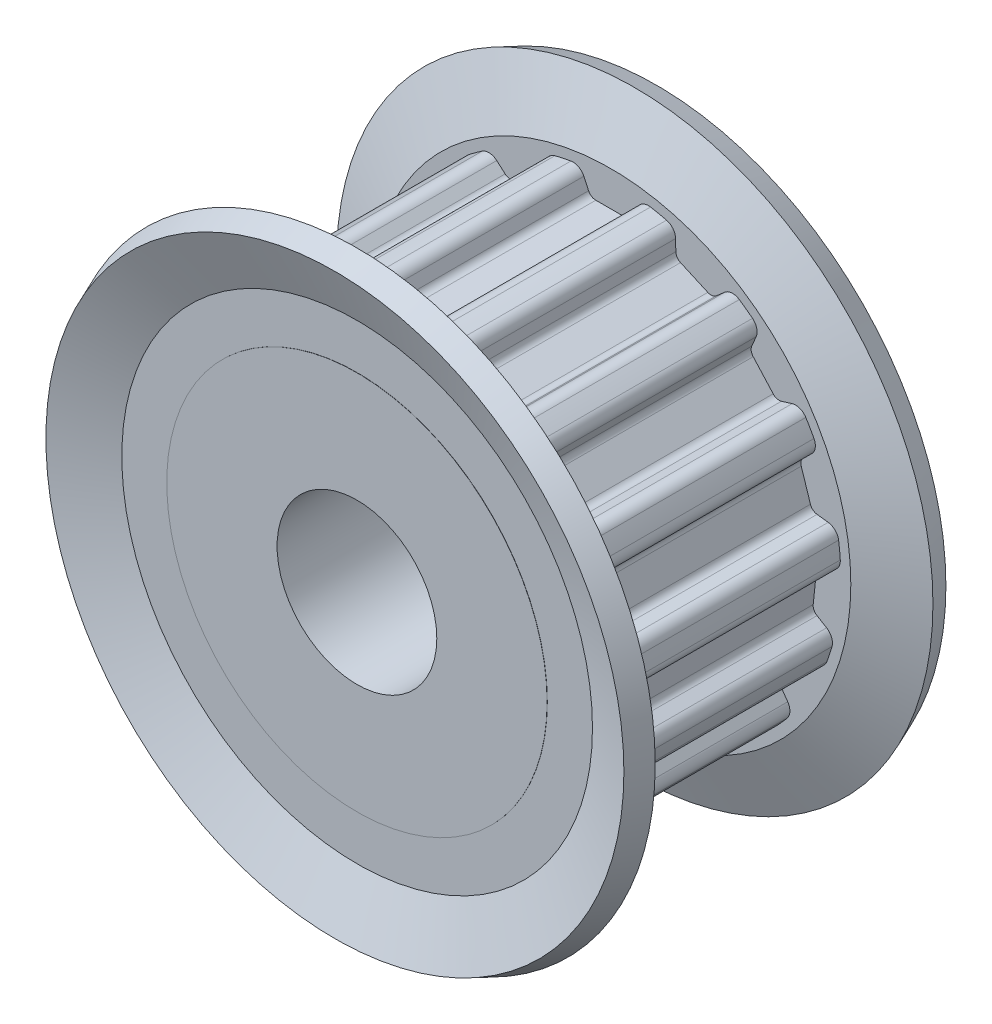
from build123d import *

# Parameters (mm, degrees)
TOOTHEXTRUDECUTGEARBELT01_DEPTH = 5.749999914
PATTERNGEARBELT01_COUNT         = 15
BOREREVOLVESKETCH_W             = 13.91999979
BOREREVOLVESKETCH_H             = 4


with BuildPart() as part:
    # SketchRevolveGearBelt01 → GearBelt01 (revolve)
    with BuildSketch(Plane(origin=(0, 0, 0), x_dir=(0, 0, -1), z_dir=(1, 0, 0))):
        Polygon((6.959999895, 0), (6.959999895, 9.524999857), (6.949999896, 9.524999857), (6.949999896, 11.786304982), (8.063312621, 14.474079664), (6.954657199, 14.933299776), (5.749999914, 12.024999819), (5.749999914, 11.525000827), (-5.749999914, 11.525000827), (-5.749999914, 12.024999819), (-6.954657199, 14.933299776), (-8.063312621, 14.474079664), (-6.949999896, 11.786304982), (-6.949999896, 9.524999857), (-6.959999895, 9.524999857), (-6.959999895, 0), align=None)
    revolve(axis=Axis((0, 0, 0), (0, 0, -1)))

    # SketchToothGearBelt01 → ToothExtrudeCutGearBelt01 (cut, symmetric)
    with BuildSketch(Plane.XY):
        with BuildLine():
            Line((-1.346605253, 11.013778629), (-1.109802523, 10.505953538))
            ThreePointArc((-1.109802523, 10.505953538), (-0.962199254, 10.337644266), (-0.747279414, 10.275000846))
            Line((-0.747279414, 10.275000846), (0.747279414, 10.275000846))
            ThreePointArc((0.747279414, 10.275000846), (0.962199254, 10.337644266), (1.109802523, 10.505953538))
            Line((1.109802523, 10.505953538), (1.346605253, 11.013778629))
            ThreePointArc((1.346605253, 11.013778629), (1.613174654, 11.292327669), (1.994209948, 11.351157242))
            Line((1.994209948, 11.351157242), (0, 13.891157204))
            Line((0, 13.891157204), (-1.994209948, 11.351157242))
            ThreePointArc((-1.994209948, 11.351157242), (-1.613174654, 11.292327669), (-1.346605253, 11.013778629))
        make_face()
    toothextrudecutgearbelt01 = extrude(amount=TOOTHEXTRUDECUTGEARBELT01_DEPTH, both=True, mode=Mode.SUBTRACT)

    # PatternGearBelt01: ToothExtrudeCutGearBelt01 ×15 about axis
    patterngearbelt01_axis = Axis((0, 0, 73.267743304), (0, 0, -1))
    for i in range(1, PATTERNGEARBELT01_COUNT):
        add(toothextrudecutgearbelt01.rotate(patterngearbelt01_axis, i * 360 / PATTERNGEARBELT01_COUNT), mode=Mode.SUBTRACT)

    # BoreRevolveSketch → BoreRevolveCut (revolve, cut)
    with BuildSketch(Plane(origin=(0, 0, 0), x_dir=(0, 0, -1), z_dir=(1, 0, 0))):
        with Locations((0, 2)):
            Rectangle(BOREREVOLVESKETCH_W, BOREREVOLVESKETCH_H)
    revolve(axis=Axis((0, 0, 0), (0, 0, -1)), mode=Mode.SUBTRACT)


solid = part.part
